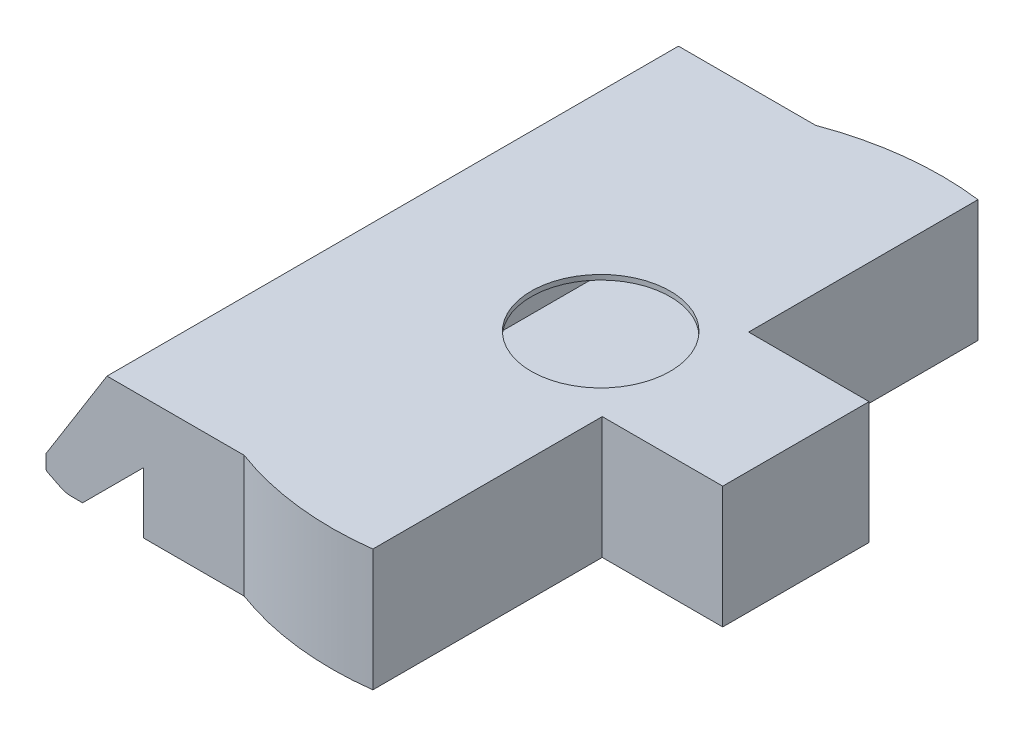
from build123d import *

# Parameters (mm, degrees)
SKETCH1_W           = 109
SKETCH1_H           = 60
BOSS_EXTRUDE1_DEPTH = 50
CUT_EXTRUDE1_DEPTH  = 500
SHELL2_T            = -2
CUT_EXTRUDE2_DEPTH  = 500
FILLET1_R           = 1
FILLET2_R           = 10
SKETCH4_R           = 28.5
CUT_EXTRUDE3_DEPTH  = 5


with BuildPart() as part:
    # Sketch1 → Boss-Extrude1 (new body)
    with BuildSketch(Plane(origin=(0, 0, 0), x_dir=(1, 0, 0), z_dir=(0, 1, 0))):
        with BuildLine():
            ThreePointArc((-348.004117683, 21.026446367), (-325.093541396, 91.023149879), (-266.754117683, 135.978067844))
            Line((-266.754117683, 135.978067844), (-348.004117683, 135.978067844))
            Line((-348.004117683, 135.978067844), (-348.004117683, 21.026446367))
        make_face()
        with BuildLine():
            Line((-266.754117683, -98.261932156), (-266.754117683, 135.978067844))
            ThreePointArc((-266.754117683, 135.978067844), (-325.093541396, 91.023149879), (-348.004117683, 21.026446367))
            Line((-348.004117683, 21.026446367), (-348.004117683, 16.688022305))
            ThreePointArc((-348.004117683, 16.688022305), (-325.094915866, -53.306736582), (-266.758579073, -98.261932156))
            Line((-266.758579073, -98.261932156), (-266.754117683, -98.261932156))
        make_face()
        with BuildLine():
            Line((-348.004117683, -98.261932156), (-266.758579073, -98.261932156))
            ThreePointArc((-266.758579073, -98.261932156), (-325.094915866, -53.306736582), (-348.004117683, 16.688022305))
            Line((-348.004117683, 16.688022305), (-348.004117683, -98.261932156))
        make_face()
        with BuildLine():
            Line((-266.743984385, 48.857234336), (-207.123984385, 48.857234336))
            Line((-207.123984385, 48.857234336), (-207.123984385, 142.874902464))
            ThreePointArc((-207.123984385, 142.874902464), (-237.359097186, 143.058210347), (-266.754117683, 135.978067844))
            Line((-266.754117683, 135.978067844), (-266.754117683, -98.261932156))
            Line((-266.754117683, -98.261932156), (-266.758579073, -98.261932156))
            ThreePointArc((-266.758579073, -98.261932156), (-237.361462745, -105.343468051), (-207.123984385, -105.160433792))
            Line((-207.123984385, -105.160433792), (-207.123984385, -11.142765664))
            Line((-207.123984385, -11.142765664), (-266.743984385, -11.142765664))
            Line((-266.743984385, -11.142765664), (-266.743984385, 48.857234336))
        make_face()
        with Locations((-212.243984385, 18.857234336)):
            Rectangle(SKETCH1_W, SKETCH1_H)
    extrude(amount=BOSS_EXTRUDE1_DEPTH)

    # Sketch2 → Cut-Extrude1 (cut)
    with BuildSketch(Plane.XY.offset(98.261932156)):
        Polygon((-348.004117683, 50), (-348.004117683, 10), (-323.004117683, 50), align=None)
        Polygon((-308.004117683, 25), (-333.004117683, 0), (-308.004117683, 0), align=None)
    extrude(amount=-CUT_EXTRUDE1_DEPTH, mode=Mode.SUBTRACT)

    # Shell2
    shell2_openings = [part.faces().sort_by_distance(p)[0] for p in [
        (-340.504117683, 0, -18.858067844),
    ]]
    offset(amount=SHELL2_T, openings=shell2_openings, kind=Kind.INTERSECTION)

    # Sketch3 → Cut-Extrude2 (cut)
    with BuildSketch(Plane.XY.offset(98.261932156)):
        Polygon((-348.004117683, 0), (-348.004117683, 4), (-340.004117683, 0), align=None)
    extrude(amount=-CUT_EXTRUDE2_DEPTH, mode=Mode.SUBTRACT)

    # Fillet1
    fillet1_edges = [part.edges().sort_by_distance(p)[0] for p in [
        (-348.004117683, 4, -18.858067844),
        (-346.004117683, 3, -18.858067844),
    ]]
    fillet(fillet1_edges, radius=FILLET1_R - 0.0001)  # a hair under: the kernel refuses the full size

    # Fillet2
    fillet2_edges = [part.edges().sort_by_distance(p)[0] for p in [
        (-340.004117683, 0, -134.978067844),
        (-340.004117683, 0, 97.261932156),
    ]]
    fillet(fillet2_edges, radius=FILLET2_R)

    # Sketch4 → Cut-Extrude3 (cut)
    with BuildSketch(Plane(origin=(0, 50, 0), x_dir=(1, 0, 0), z_dir=(0, 1, 0))):
        with Locations(Location((-237.743984385, 18.857234336, 0), (0, 0, 270))):
            Circle(SKETCH4_R)
    extrude(amount=-CUT_EXTRUDE3_DEPTH, mode=Mode.SUBTRACT)


solid = part.part
